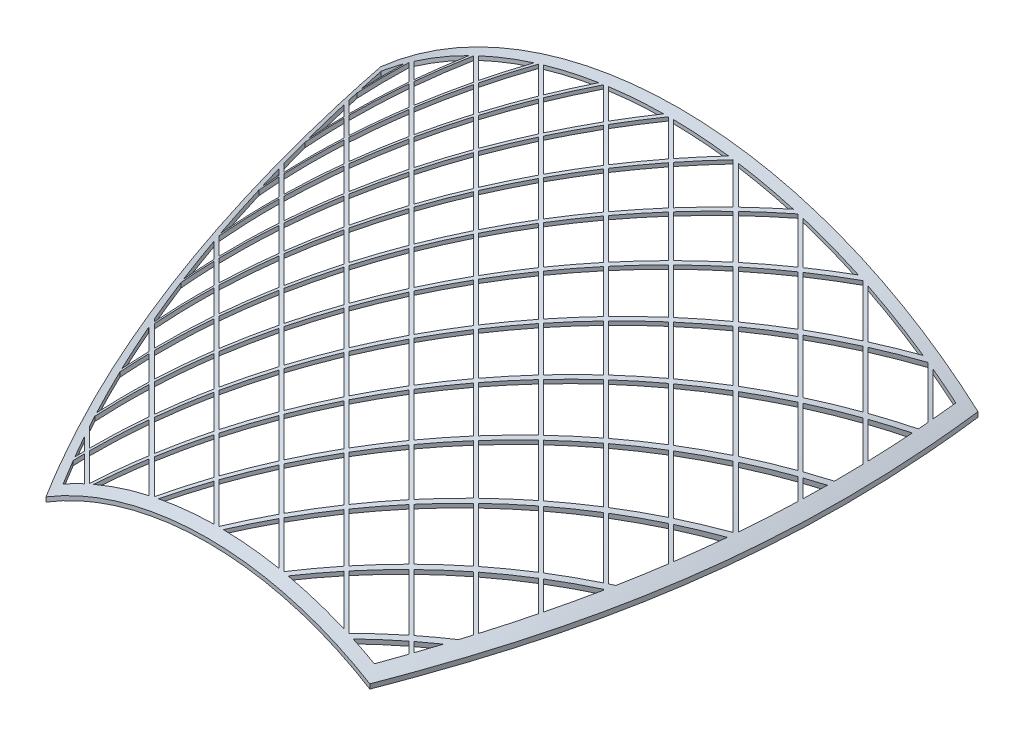
from build123d import *

# Parameters (mm, degrees)
REVOLVE_3_ANGLE        = 90
EXTRUDE_3_DEPTH        = 125.852789
SHELL_3_T              = -3
RIB_1_REACH            = 214.307
PATTERN_LINEAR_4_COUNT = 14
PATTERN_LINEAR_4_PITCH = 12.75


with BuildPart() as part:
    # Эскиз6 → Повернуть-Тонкостенный3 (revolve, symmetric)
    with BuildSketch(Plane(origin=(0, 0, 0), x_dir=(0, 0, -1), z_dir=(1, 0, 0))) as revolve_3_sk:
        with BuildLine():
            ThreePointArc((-146, 80.574466041), (-71.93327852, 107.99350983), (5, 125.852788911))
            Line((5, 125.852788911), (5.164128483, 124.866349941))
            ThreePointArc((5.164128483, 124.866349941), (-71.646056791, 107.035645707), (-145.594271517, 79.660472387))
            Line((-145.594271517, 79.660472387), (-146, 80.574466041))
        make_face()
    revolve(axis=Axis((0, 0, 0), (0, 0, 1)), revolution_arc=REVOLVE_3_ANGLE / 2)
    revolve(revolve_3_sk.sketch, axis=Axis((0, 0, 0), (0, 0, -1)), revolution_arc=REVOLVE_3_ANGLE / 2)


with BuildPart() as body_2:
    # Эскиз4 → Бобышка-Вытянуть3 (new body)
    with BuildSketch(Plane(origin=(0, 0, 0), x_dir=(1, 0, 0), z_dir=(0, 1, 0))):
        with BuildLine():
            Line((-83, 0), (83, 0))
            ThreePointArc((83, 0), (71.756415779, -67.749952669), (45, -131))
            Line((45, -131), (-45, -131))
            ThreePointArc((-45, -131), (-71.756415779, -67.749952669), (-83, 0))
        make_face()
    extrude(amount=EXTRUDE_3_DEPTH)

    # Оболочка3
    shell_3_openings = [body_2.faces().sort_by_distance(p)[0] for p in [
        (0, 125.852789, 59.614369669),
    ]]
    offset(amount=SHELL_3_T, openings=shell_3_openings, kind=Kind.INTERSECTION)

    # Эскиз11 walls → Ребро1 (add, up to next)
    with BuildSketch(Plane(origin=(0, 125.852788911, 0), x_dir=(1, 0, 0), z_dir=(0, 1, 0)), mode=Mode.PRIVATE) as rib_1_sk1:
        Polygon((-78.415900029, 147.477480056), (229.860527442, -160.798947414), (230.567634223, -160.091840633), (-77.708793247, 148.184586837), align=None)
    rib_1_tool1 = extrude(rib_1_sk1.sketch, amount=-RIB_1_REACH, mode=Mode.PRIVATE) - body_2.part
    rib_1 = rib_1_tool1.solids().sort_by_distance((76.075867097, 125.852788911, 6.307180289))[0]
    add(rib_1)

    # Линейный массив4: Ребро1; each copy of Ребро1 runs up to whatever stops it at its own place
    pattern_linear_4_before = body_2.part  # the part as the pattern finds it: every copy runs up to it
    pattern_linear_4_rib_1_long = extrude(rib_1_sk1.sketch, amount=-RIB_1_REACH, mode=Mode.PRIVATE)
    pattern_linear_4_rib_1_tool1 = pattern_linear_4_rib_1_long.moved(Location(Vector(-0.7071067811865513, 0, 0.7071067811865438) * (1 * PATTERN_LINEAR_4_PITCH))) - pattern_linear_4_before
    add(pattern_linear_4_rib_1_tool1.solids().sort_by_distance((67.060256, 125.852789, 15.322792))[0])
    pattern_linear_4_rib_1_tool2 = pattern_linear_4_rib_1_long.moved(Location(Vector(-0.7071067811865513, 0, 0.7071067811865438) * (2 * PATTERN_LINEAR_4_PITCH))) - pattern_linear_4_before
    add(pattern_linear_4_rib_1_tool2.solids().sort_by_distance((58.044644, 125.852789, 24.338403))[0])
    pattern_linear_4_rib_1_tool3 = pattern_linear_4_rib_1_long.moved(Location(Vector(-0.7071067811865513, 0, 0.7071067811865438) * (3 * PATTERN_LINEAR_4_PITCH))) - pattern_linear_4_before
    add(pattern_linear_4_rib_1_tool3.solids().sort_by_distance((49.029033, 125.852789, 33.354015))[0])
    pattern_linear_4_rib_1_tool4 = pattern_linear_4_rib_1_long.moved(Location(Vector(-0.7071067811865513, 0, 0.7071067811865438) * (4 * PATTERN_LINEAR_4_PITCH))) - pattern_linear_4_before
    add(pattern_linear_4_rib_1_tool4.solids().sort_by_distance((40.013421, 125.852789, 42.369626))[0])
    pattern_linear_4_rib_1_tool5 = pattern_linear_4_rib_1_long.moved(Location(Vector(-0.7071067811865513, 0, 0.7071067811865438) * (5 * PATTERN_LINEAR_4_PITCH))) - pattern_linear_4_before
    add(pattern_linear_4_rib_1_tool5.solids().sort_by_distance((30.99781, 125.852789, 51.385238))[0])
    pattern_linear_4_rib_1_tool6 = pattern_linear_4_rib_1_long.moved(Location(Vector(-0.7071067811865513, 0, 0.7071067811865438) * (6 * PATTERN_LINEAR_4_PITCH))) - pattern_linear_4_before
    add(pattern_linear_4_rib_1_tool6.solids().sort_by_distance((21.982198, 125.852789, 60.400849))[0])
    pattern_linear_4_rib_1_tool7 = pattern_linear_4_rib_1_long.moved(Location(Vector(-0.7071067811865513, 0, 0.7071067811865438) * (7 * PATTERN_LINEAR_4_PITCH))) - pattern_linear_4_before
    add(pattern_linear_4_rib_1_tool7.solids().sort_by_distance((12.966587, 125.852789, 69.416461))[0])
    pattern_linear_4_rib_1_tool8 = pattern_linear_4_rib_1_long.moved(Location(Vector(-0.7071067811865513, 0, 0.7071067811865438) * (8 * PATTERN_LINEAR_4_PITCH))) - pattern_linear_4_before
    add(pattern_linear_4_rib_1_tool8.solids().sort_by_distance((3.950975, 125.852789, 78.432072))[0])
    pattern_linear_4_rib_1_tool9 = pattern_linear_4_rib_1_long.moved(Location(Vector(-0.7071067811865513, 0, 0.7071067811865438) * (9 * PATTERN_LINEAR_4_PITCH))) - pattern_linear_4_before
    add(pattern_linear_4_rib_1_tool9.solids().sort_by_distance((-5.064636, 125.852789, 87.447683))[0])
    pattern_linear_4_rib_1_tool10 = pattern_linear_4_rib_1_long.moved(Location(Vector(-0.7071067811865513, 0, 0.7071067811865438) * (10 * PATTERN_LINEAR_4_PITCH))) - pattern_linear_4_before
    add(pattern_linear_4_rib_1_tool10.solids().sort_by_distance((-14.080248, 125.852789, 96.463295))[0])
    pattern_linear_4_rib_1_tool11 = pattern_linear_4_rib_1_long.moved(Location(Vector(-0.7071067811865513, 0, 0.7071067811865438) * (11 * PATTERN_LINEAR_4_PITCH))) - pattern_linear_4_before
    add(pattern_linear_4_rib_1_tool11.solids().sort_by_distance((-23.095859, 125.852789, 105.478906))[0])
    pattern_linear_4_rib_1_tool12 = pattern_linear_4_rib_1_long.moved(Location(Vector(-0.7071067811865513, 0, 0.7071067811865438) * (12 * PATTERN_LINEAR_4_PITCH))) - pattern_linear_4_before
    add(pattern_linear_4_rib_1_tool12.solids().sort_by_distance((-32.11147, 125.852789, 114.494518))[0])
    pattern_linear_4_rib_1_tool13 = pattern_linear_4_rib_1_long.moved(Location(Vector(-0.7071067811865513, 0, 0.7071067811865438) * (13 * PATTERN_LINEAR_4_PITCH))) - pattern_linear_4_before
    add(pattern_linear_4_rib_1_tool13.solids().sort_by_distance((-41.127082, 125.852789, 123.510129))[0])

    # Зеркальное отражение5: body 2 across plane


with BuildPart() as body_2_1:
    add(body_2.part)
    add(body_2.part.mirror(Plane(origin=(0, 0, 0), x_dir=(0, 0, 1), z_dir=(1, 0, 0))))

    # Combine 1: intersect part
    add(part.part, mode=Mode.INTERSECT)


solid = body_2_1.part
